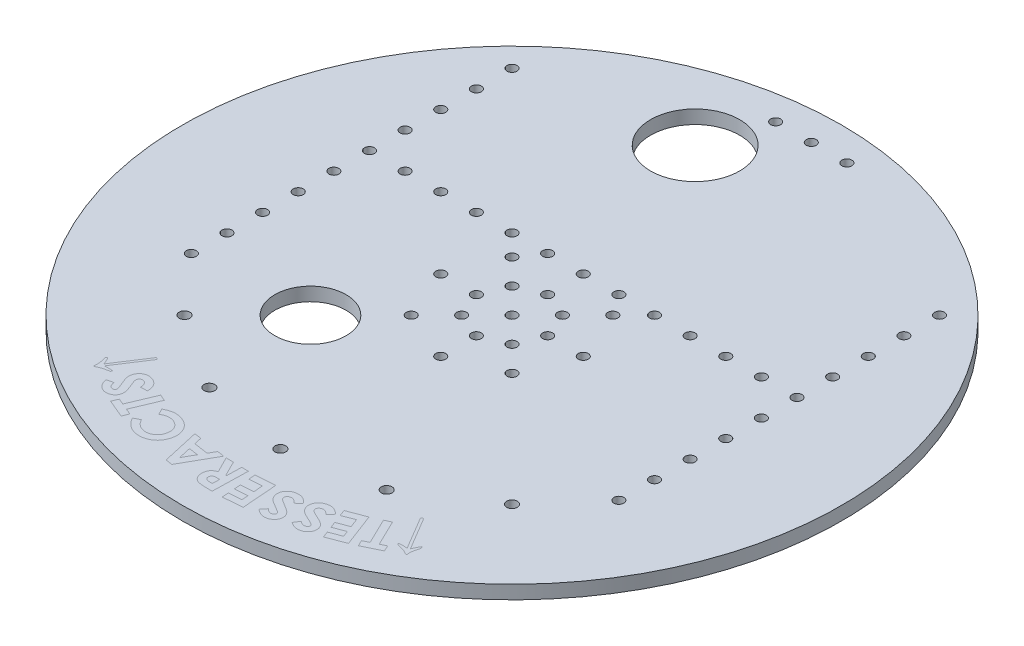
from build123d import *

# Parameters (mm, degrees)
SKETCH1_R           = 117.475
BOSS_EXTRUDE1_DEPTH = 4.826
SKETCH4_R           = 1.778
CUT_EXTRUDE5_DEPTH  = 167.204817999
SKETCH5_R           = 1.778
CUT_EXTRUDE6_DEPTH  = 167.204817999
SKETCH6_R           = 1.778
CUT_EXTRUDE7_DEPTH  = 167.204817999
SKETCH9_R           = 1.905
CUT_EXTRUDE10_DEPTH = 167.204817999
CIRPATTERN1_COUNT   = 3
CIRPATTERN1_ANGLE   = 45
CIRPATTERN2_COUNT   = 3
CIRPATTERN2_ANGLE   = 45
SKETCH7_R           = 1.778
CUT_EXTRUDE8_DEPTH  = 167.204817999
SKETCH8_R           = 12.7
CUT_EXTRUDE9_DEPTH  = 167.204817999
SKETCH10_R          = 15.875
CUT_EXTRUDE11_DEPTH = 167.204817999
SKETCH15_R          = 1.778
CUT_EXTRUDE12_DEPTH = 167.204817999


with BuildPart() as part:
    # Sketch1 → Boss-Extrude1 (new body)
    with BuildSketch(Plane(origin=(0, 0, 0), x_dir=(1, 0, 0), z_dir=(0, 1, 0))):
        Circle(SKETCH1_R)
    extrude(amount=-BOSS_EXTRUDE1_DEPTH)

    # Sketch4 → Cut-Extrude5 (cut, through all)
    with BuildSketch(Plane(origin=(0, 0, 0), x_dir=(1, 0, 0), z_dir=(0, 1, 0))):
        with Locations((-76.2, 0)):
            Circle(SKETCH4_R)
        with Locations((-76.2, 12.7)):
            Circle(SKETCH4_R)
        with Locations((-76.2, 25.4)):
            Circle(SKETCH4_R)
        with Locations((-76.2, 38.1)):
            Circle(SKETCH4_R)
        with Locations((-76.2, -12.7)):
            Circle(SKETCH4_R)
        with Locations((-76.2, -25.4)):
            Circle(SKETCH4_R)
        with Locations((-76.2, -38.1)):
            Circle(SKETCH4_R)
        with Locations((-76.2, 50.8)):
            Circle(SKETCH4_R)
        with Locations((-76.2, 63.5)):
            Circle(SKETCH4_R)
        with Locations((-76.2, 76.2)):
            Circle(SKETCH4_R)
    cut_extrude5 = extrude(amount=-CUT_EXTRUDE5_DEPTH, mode=Mode.SUBTRACT)

    # Mirror3: Cut-Extrude5 across plane
    add(cut_extrude5.mirror(Plane(origin=(0, 0, 0), x_dir=(0, 0, 1), z_dir=(1, 0, 0))), mode=Mode.SUBTRACT)

    # Sketch5 → Cut-Extrude6 (cut, through all)
    with BuildSketch(Plane(origin=(0, 0, 0), x_dir=(1, 0, 0), z_dir=(0, 1, 0))):
        Circle(SKETCH5_R)
    extrude(amount=-CUT_EXTRUDE6_DEPTH, mode=Mode.SUBTRACT)

    # Sketch6 → Cut-Extrude7 (cut, through all)
    with BuildSketch(Plane(origin=(0, 0, 0), x_dir=(1, 0, 0), z_dir=(0, 1, 0))):
        with Locations((0, 25.4)):
            Circle(SKETCH6_R)
        with Locations((-12.7, 25.4)):
            Circle(SKETCH6_R)
        with Locations((-25.4, 25.4)):
            Circle(SKETCH6_R)
        with Locations((-38.1, 25.4)):
            Circle(SKETCH6_R)
        with Locations((12.7, 25.4)):
            Circle(SKETCH6_R)
        with Locations((25.4, 25.4)):
            Circle(SKETCH6_R)
        with Locations((38.1, 25.4)):
            Circle(SKETCH6_R)
        with Locations((-50.8, 25.4)):
            Circle(SKETCH6_R)
        with Locations((50.8, 25.4)):
            Circle(SKETCH6_R)
        with Locations((-63.5, 25.4)):
            Circle(SKETCH6_R)
        with Locations((63.5, 25.4)):
            Circle(SKETCH6_R)
        with Locations((0, 106.68)):
            Circle(SKETCH6_R)
        with Locations((-12.7, 106.68)):
            Circle(SKETCH6_R)
        with Locations((12.7, 106.68)):
            Circle(SKETCH6_R)
    extrude(amount=-CUT_EXTRUDE7_DEPTH, mode=Mode.SUBTRACT)

    # Sketch9 → Cut-Extrude10 (cut, through all)
    with BuildSketch(Plane(origin=(0, 0, 0), x_dir=(1, 0, 0), z_dir=(0, 1, 0))):
        with Locations((0, -82.55)):
            Circle(SKETCH9_R)
    cut_extrude10 = extrude(amount=-CUT_EXTRUDE10_DEPTH, mode=Mode.SUBTRACT)

    # CirPattern1: Cut-Extrude10 ×3 about axis
    cirpattern1_axis = Axis((0, -4.826, 0), (0, 1, 0))
    for i in range(1, CIRPATTERN1_COUNT):
        add(cut_extrude10.rotate(cirpattern1_axis, i * CIRPATTERN1_ANGLE / (CIRPATTERN1_COUNT - 1)), mode=Mode.SUBTRACT)

    # CirPattern2: Cut-Extrude10 ×3 about axis
    cirpattern2_axis = Axis((0, -4.826, 0), (0, -1, 0))
    for i in range(1, CIRPATTERN2_COUNT):
        add(cut_extrude10.rotate(cirpattern2_axis, i * CIRPATTERN2_ANGLE / (CIRPATTERN2_COUNT - 1)), mode=Mode.SUBTRACT)

    # Sketch7 → Cut-Extrude8 (cut, through all)
    with BuildSketch(Plane(origin=(0, 0, 0), x_dir=(1, 0, 0), z_dir=(0, 1, 0))):
        with Locations((0, 12.7)):
            Circle(SKETCH7_R)
        with Locations((12.7, 0)):
            Circle(SKETCH7_R)
        with Locations((0, -12.7)):
            Circle(SKETCH7_R)
        with Locations((-12.7, 0)):
            Circle(SKETCH7_R)
        with Locations((-8.980256121, 8.980256121)):
            Circle(SKETCH7_R)
        with Locations((8.980256121, 8.980256121)):
            Circle(SKETCH7_R)
        with Locations((8.980256121, -8.980256121)):
            Circle(SKETCH7_R)
        with Locations((-8.980256121, -8.980256121)):
            Circle(SKETCH7_R)
    extrude(amount=-CUT_EXTRUDE8_DEPTH, mode=Mode.SUBTRACT)

    # Sketch8 → Cut-Extrude9 (cut, through all)
    with BuildSketch(Plane(origin=(0, 0, 0), x_dir=(1, 0, 0), z_dir=(0, 1, 0))):
        with Locations((-35.921024484, -35.921024484)):
            Circle(SKETCH8_R)
    extrude(amount=-CUT_EXTRUDE9_DEPTH, mode=Mode.SUBTRACT)

    # Sketch10 → Cut-Extrude11 (cut, through all)
    with BuildSketch(Plane(origin=(0, 0, 0), x_dir=(1, 0, 0), z_dir=(0, 1, 0))):
        with Locations((-19.812, 85.09)):
            Circle(SKETCH10_R)
    extrude(amount=-CUT_EXTRUDE11_DEPTH, mode=Mode.SUBTRACT)

    # Sketch15 → Cut-Extrude12 (cut, through all)
    with BuildSketch(Plane(origin=(0, 0, 0), x_dir=(1, 0, 0), z_dir=(0, 1, 0))):
        with Locations((25.4, 0)):
            Circle(SKETCH15_R)
        with Locations((17.960512242, -17.960512242)):
            Circle(SKETCH15_R)
        with Locations((0, -25.4)):
            Circle(SKETCH15_R)
        with Locations((-17.960512242, -17.960512242)):
            Circle(SKETCH15_R)
        with Locations((-25.4, 0)):
            Circle(SKETCH15_R)
        with Locations((-17.960512242, 17.960512242)):
            Circle(SKETCH15_R)
        with Locations((0, 25.4)):
            Circle(SKETCH15_R)
        with Locations((17.960512242, 17.960512242)):
            Circle(SKETCH15_R)
    extrude(amount=-CUT_EXTRUDE12_DEPTH, mode=Mode.SUBTRACT)


solid = part.part
